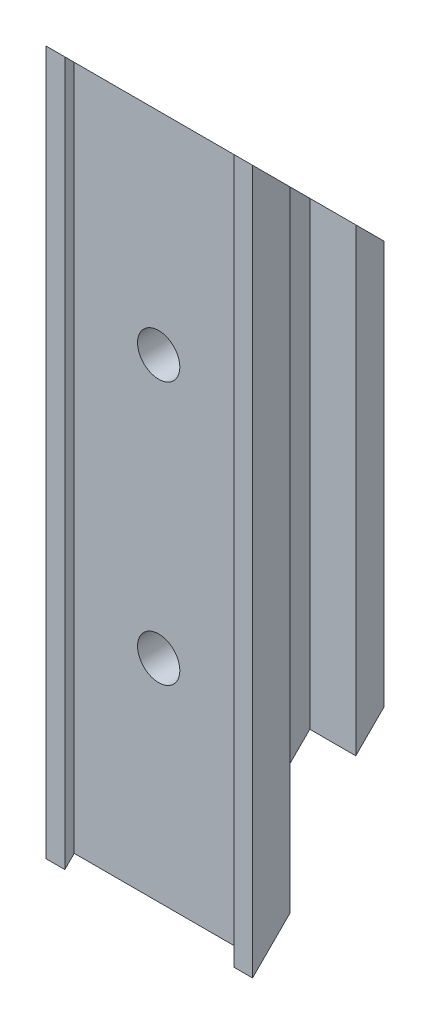
from build123d import *

# Parameters (mm, degrees)
BOSS_EXTRUDE1_DEPTH                                 = 37.5
CHAMFER1_SIZE                                       = 18
CHAMFER2_SIZE                                       = 2
CSK_FOR_M4_COUNTERSUNK_FLAT_HEAD_SCREW1_D           = 4.5
CSK_FOR_M4_COUNTERSUNK_FLAT_HEAD_SCREW1_CSINK_D     = 9.4
CSK_FOR_M4_COUNTERSUNK_FLAT_HEAD_SCREW1_CSINK_ANGLE = 90


with BuildPart() as part:
    # Sketch1 → Boss-Extrude1 (new, symmetric)
    with BuildSketch(Plane(origin=(0, 0, 0), x_dir=(1, 0, 0), z_dir=(0, 1, 0))):
        Polygon((-9, 1), (9, 1), (9, 0), (11, 0), (11, 4), (4.1, 4), (4.1, 13), (9, 13), (9, 18), (-9, 18), (-9, 13), (-4.1, 13), (-4.1, 4), (-11, 4), (-11, 0), (-9, 0), align=None)
    extrude(amount=BOSS_EXTRUDE1_DEPTH, both=True)

    # Chamfer1
    # the kernel refuses this chamfer: 18 mm, written as the material it takes off along each edge
    with BuildSketch(Plane(origin=(55.290293783, -37.5, -18), x_dir=(0, 0.9996219169112966, -0.02749587661058639), z_dir=(-1, 0, 0))) as chamfer1_piece_1:
        Polygon((CHAMFER1_SIZE * 0.999621916911, -CHAMFER1_SIZE * 0.0274958766106), (-CHAMFER1_SIZE * 0.0274958766106, -CHAMFER1_SIZE * 0.999621916911), (0, 0), align=None)
    extrude(amount=110.580587567, mode=Mode.SUBTRACT)
    with BuildSketch(Plane(origin=(55.290293783, 37.5, -18), x_dir=(0, -0.9996219169112966, -0.02749587661058639), z_dir=(-1, 0, 0))) as chamfer1_piece_2:
        Polygon((CHAMFER1_SIZE * 0.999621916911, CHAMFER1_SIZE * 0.0274958766106), (-CHAMFER1_SIZE * 0.0274958766106, CHAMFER1_SIZE * 0.999621916911), (0, 0), align=None)
    extrude(amount=110.580587567, mode=Mode.SUBTRACT)

    # Chamfer2
    chamfer2_edges = [part.edges().sort_by_distance(p)[0] for p in [
        (-9, 0, -18),
        (9, 0, -18),
    ]]
    chamfer(chamfer2_edges, length=CHAMFER2_SIZE)

    # CSK for M4 Countersunk Flat Head Screw1 (through all)
    with Locations(Plane(origin=(0, 0, -18), x_dir=(-1, 0, 0), z_dir=(0, 0, -1))):
        with Locations((0, 14), (0, -14)):
            CounterSinkHole(CSK_FOR_M4_COUNTERSUNK_FLAT_HEAD_SCREW1_D / 2, CSK_FOR_M4_COUNTERSUNK_FLAT_HEAD_SCREW1_CSINK_D / 2, counter_sink_angle=CSK_FOR_M4_COUNTERSUNK_FLAT_HEAD_SCREW1_CSINK_ANGLE)


solid = part.part
